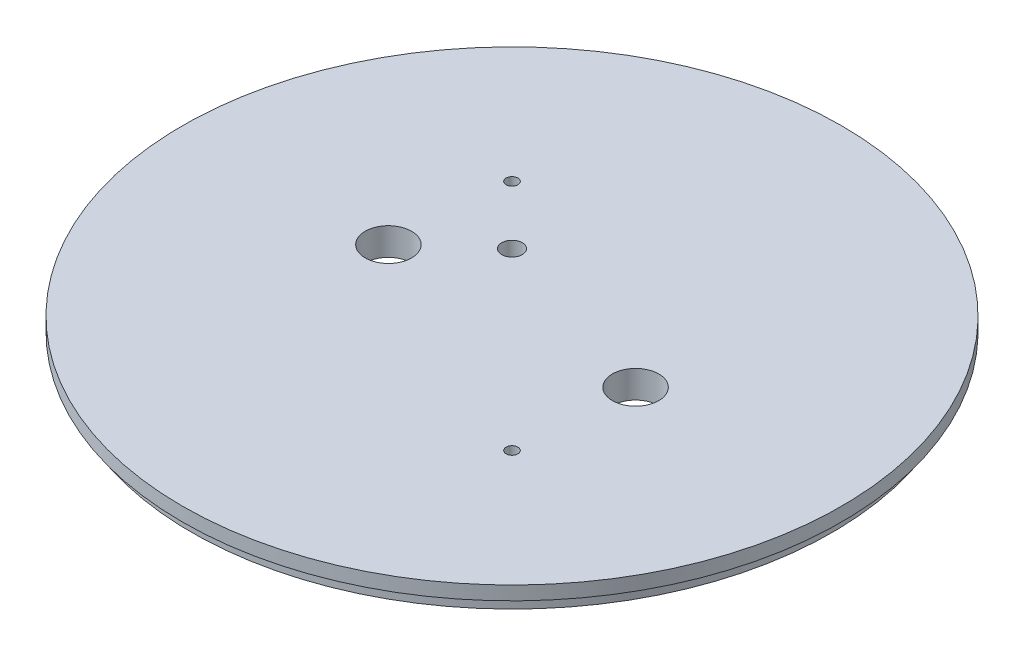
from build123d import *

# Parameters (mm, degrees)
SKETCH1_R           = 76.2
SKETCH1_R_2         = 5.3578125
SKETCH1_R_3         = 1.3589
SKETCH1_R_4         = 2.38125
BOSS_EXTRUDE1_DEPTH = 6.35
SKETCH2_R           = 76.2
SKETCH2_R_2         = 74.041
CUT_EXTRUDE1_DEPTH  = 3.175
CUT_EXTRUDE2_START  = -5.969
CUT_EXTRUDE2_DEPTH  = 3.556


with BuildPart() as part:
    # Sketch1 → Boss-Extrude1 (new body)
    with BuildSketch(Plane(origin=(0, 0, 0), x_dir=(1, 0, 0), z_dir=(0, 1, 0))):
        Circle(SKETCH1_R)
        with Locations((28.575, 0)):
            Circle(SKETCH1_R_2, mode=Mode.SUBTRACT)
        with Locations((-28.575, 0)):
            Circle(SKETCH1_R_2, mode=Mode.SUBTRACT)
        with Locations((-26.940768363, 26.940768363)):
            Circle(SKETCH1_R_3, mode=Mode.SUBTRACT)
        with Locations((26.940768363, -26.940768363)):
            Circle(SKETCH1_R_3, mode=Mode.SUBTRACT)
        with Locations((-13.470384182, 13.470384182)):
            Circle(SKETCH1_R_4, mode=Mode.SUBTRACT)
    extrude(amount=BOSS_EXTRUDE1_DEPTH)

    # Sketch2 → Cut-Extrude1 (cut)
    with BuildSketch(Plane.XZ):
        Circle(SKETCH2_R)
        Circle(SKETCH2_R_2, mode=Mode.SUBTRACT)
    extrude(amount=-CUT_EXTRUDE1_DEPTH, mode=Mode.SUBTRACT)

    # Sketch3 → Cut-Extrude2 (cut)
    with BuildSketch(Plane(origin=(0, 6.35, 0), x_dir=(1, 0, 0), z_dir=(0, 1, 0)).offset(CUT_EXTRUDE2_START)):
        with BuildLine():
            Line((3.2385, 34.798), (3.2385, 13.97))
            ThreePointArc((3.2385, 13.97), (0, 10.7315), (-3.2385, 13.97))
            Line((-3.2385, 13.97), (-3.2385, 34.798))
            ThreePointArc((-3.2385, 34.798), (0, 38.0365), (3.2385, 34.798))
        make_face()
        with BuildLine():
            Line((3.2385, -34.798), (3.2385, -13.97))
            ThreePointArc((3.2385, -13.97), (0, -10.7315), (-3.2385, -13.97))
            Line((-3.2385, -13.97), (-3.2385, -34.798))
            ThreePointArc((-3.2385, -34.798), (0, -38.0365), (3.2385, -34.798))
        make_face()
    extrude(amount=-CUT_EXTRUDE2_DEPTH, mode=Mode.SUBTRACT)


solid = part.part
